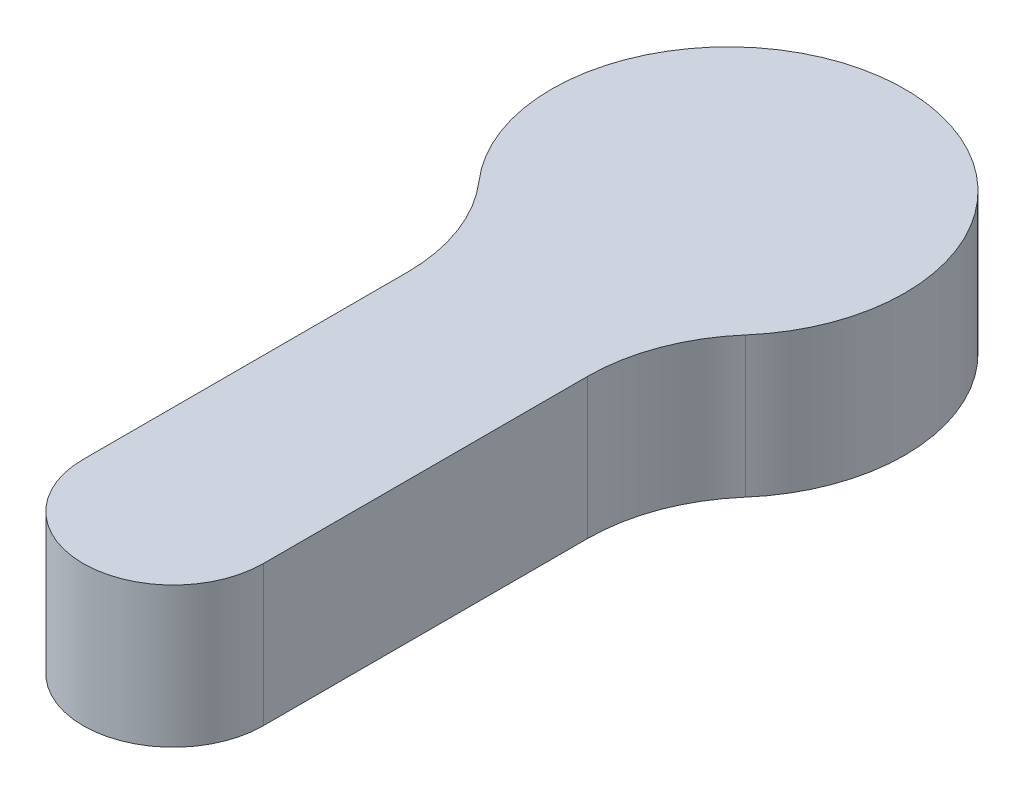
from build123d import *

# Parameters (mm, degrees)
BOSS_EXTRUDE1_DEPTH = 5.9182


with BuildPart() as part:
    # Sketch2 → Boss-Extrude1 (new body)
    with BuildSketch(Plane(origin=(0, 0, 0), x_dir=(1, 0, 0), z_dir=(0, 1, 0))):
        with BuildLine():
            Line((-3.7973, -13.651182008), (-3.7973, 0))
            ThreePointArc((-3.7973, 0), (-4.265444415, 2.584094489), (-5.610372041, 4.839725931))
            ThreePointArc((-5.610372041, 4.839725931), (0, 17.171717992), (5.610372041, 4.839725931))
            ThreePointArc((5.610372041, 4.839725931), (4.265444415, 2.584094489), (3.7973, 0))
            Line((3.7973, 0), (3.7973, -13.651182008))
            ThreePointArc((3.7973, -13.651182008), (0, -17.448482008), (-3.7973, -13.651182008))
        make_face()
    extrude(amount=BOSS_EXTRUDE1_DEPTH)


solid = part.part
